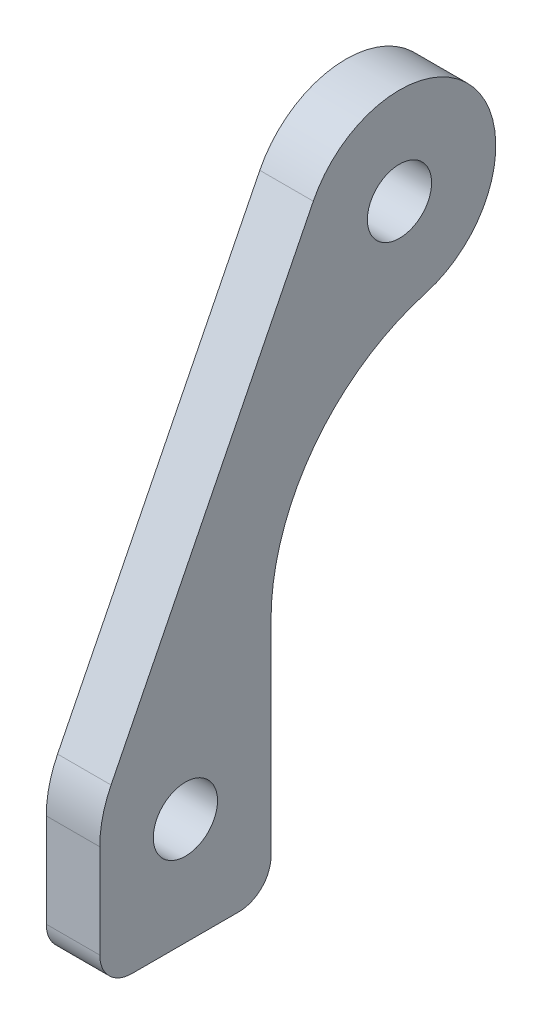
from build123d import *

# Parameters (mm, degrees)
SZKIC1_R                    = 3
DODANIE_WYCI_GNI_CIE1_DEPTH = 5


with BuildPart() as part:
    # Szkic1 → Dodanie-wyciągnięcie1 (new body)
    with BuildSketch(Plane(origin=(0, 0, 0), x_dir=(0, 0, -1), z_dir=(1, 0, 0))):
        with BuildLine():
            Line((-8, -6.999995713), (-8, 1.763932023))
            ThreePointArc((-8, 1.763932023), (-7.732489895, 4.061461228), (-6.94427191, 6.236067977))
            Line((-6.94427191, 6.236067977), (11.950155281, 44.024922359))
            ThreePointArc((11.950155281, 44.024922359), (26.922170061, 45.751831156), (22.482758621, 31.349224912))
            ThreePointArc((22.482758621, 31.349224912), (12.025883004, 24.159713627), (8, 12.12528027))
            Line((8, 12.12528027), (8, -6.999995713))
            ThreePointArc((8, -6.999995713), (7.121320344, -9.121316057), (5, -9.999995713))
            Line((5, -9.999995713), (-5, -9.999995713))
            ThreePointArc((-5, -9.999995713), (-7.121320344, -9.121316057), (-8, -6.999995713))
        make_face()
        with Locations((20, 40)):
            Circle(SZKIC1_R, mode=Mode.SUBTRACT)
        Circle(SZKIC1_R, mode=Mode.SUBTRACT)
    extrude(amount=DODANIE_WYCI_GNI_CIE1_DEPTH)


solid = part.part
